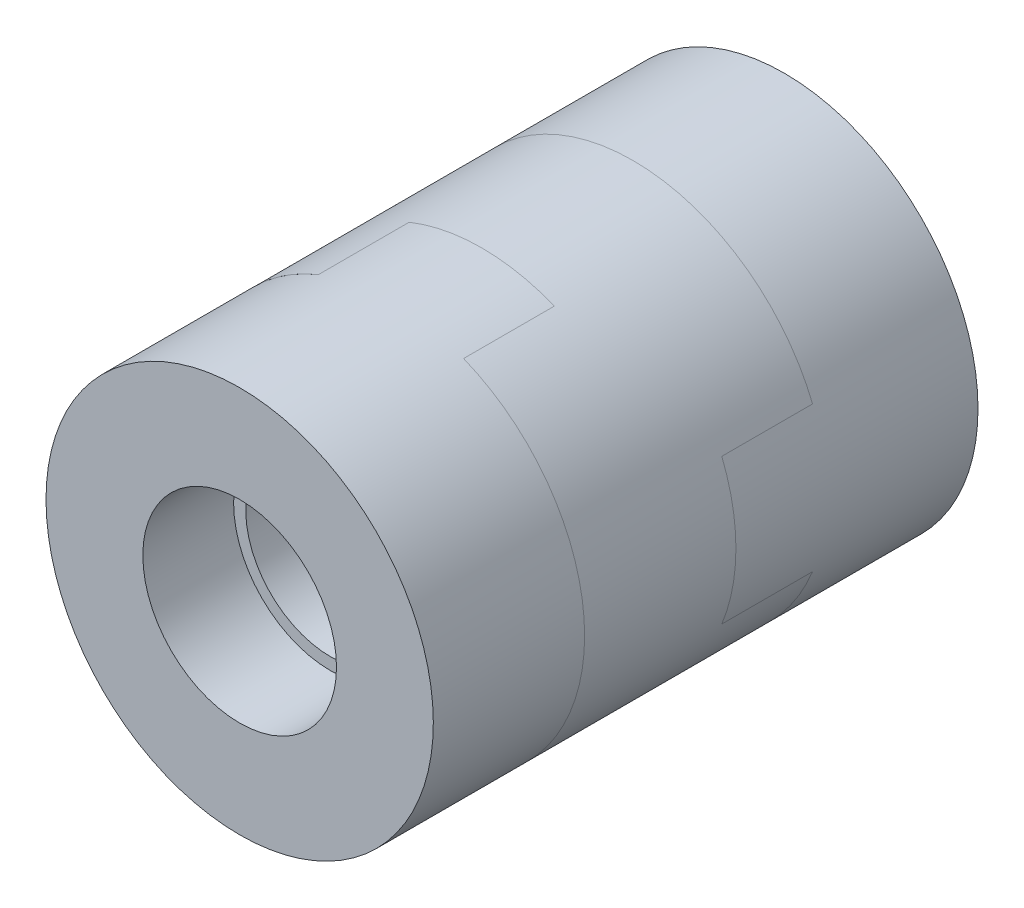
from build123d import *
from build123d.topology import SkipClean

# Parameters (mm, degrees)
CROQUIS2_R                 = 16
CROQUIS2_R_2               = 7
SALIENTE_EXTRUIR1_DEPTH    = 12.5
SALIENTE_EXTRUIR2_DEPTH    = 7.5
SALIENTE_EXTRUIR3_DEPTH    = 7.5
SALIENTE_EXTRUIR3_2_DEPTH  = 7.5
CROQUIS5_R                 = 16
CROQUIS5_R_2               = 7
SALIENTE_EXTRUIR5_DEPTH    = 5
SALIENTE_EXTRUIR7_DEPTH    = 7.5
S_LIDO_MOVER_COPIAR8_ANGLE = 180
S_LIDO_MOVER_COPIAR9_ANGLE = 90
CROQUIS7_R                 = 8
CORTAR_EXTRUIR1_DEPTH      = 7.5


with BuildPart() as part:
    # Croquis2 → Saliente-Extruir1 (new body)
    with BuildSketch(Plane.XY):
        Circle(CROQUIS2_R)
        Circle(CROQUIS2_R_2, mode=Mode.SUBTRACT)
    extrude(amount=SALIENTE_EXTRUIR1_DEPTH)

    # Croquis3 → Saliente-Extruir2 (add)
    with SkipClean():  # the faces are left unmerged after this step: merging them gives an invalid solid
        with BuildSketch(Plane.XY.offset(12.5)):
            with BuildLine():
                Line((-14.832396974, 6), (-3.605551275, 6))
                ThreePointArc((-3.605551275, 6), (-7, 0), (-3.605551275, -6))
                Line((-3.605551275, -6), (-14.832396974, -6))
                ThreePointArc((-14.832396974, -6), (-16, 0), (-14.832396974, 6))
            make_face()
            with BuildLine():
                Line((3.605551275, 6), (14.832396974, 6))
                ThreePointArc((14.832396974, 6), (16, 0), (14.832396974, -6))
                Line((14.832396974, -6), (3.605551275, -6))
                ThreePointArc((3.605551275, -6), (7, 0), (3.605551275, 6))
            make_face()
        extrude(amount=SALIENTE_EXTRUIR2_DEPTH)


with BuildPart() as body_2:
    # Croquis4 → Saliente-Extruir3 (new body)
    with BuildSketch(Plane.XY.offset(12.5)):
        with BuildLine():
            Line((-14.832396974, 6), (-3.605551275, 6))
            ThreePointArc((-3.605551275, 6), (0, 7), (3.605551275, 6))
            Line((3.605551275, 6), (14.832396974, 6))
            ThreePointArc((14.832396974, 6), (0, 16), (-14.832396974, 6))
        make_face()
    extrude(amount=SALIENTE_EXTRUIR3_DEPTH)


with BuildPart() as body_3:
    # Croquis4 → Saliente-Extruir3 2 (new body)
    with BuildSketch(Plane.XY.offset(12.5)):
        with BuildLine():
            Line((14.832396974, -6), (3.605551275, -6))
            ThreePointArc((3.605551275, -6), (0, -7), (-3.605551275, -6))
            Line((-3.605551275, -6), (-14.832396974, -6))
            ThreePointArc((-14.832396974, -6), (0, -16), (14.832396974, -6))
        make_face()
    extrude(amount=SALIENTE_EXTRUIR3_2_DEPTH)


with BuildPart() as body_4:
    # Croquis5 → Saliente-Extruir5 (new body)
    with BuildSketch(Plane.XY.offset(20)):
        Circle(CROQUIS5_R)
        Circle(CROQUIS5_R_2, mode=Mode.SUBTRACT)
    extrude(amount=SALIENTE_EXTRUIR5_DEPTH)


with BuildPart() as body_2_1:
    add(body_2.part)

    # Combinar1: union body 4, body 3
    add(body_4.part)
    add(body_3.part)

    # Croquis6 → Saliente-Extruir7 (add)
    with SkipClean():  # the faces are left unmerged after this step: merging them gives an invalid solid
        with BuildSketch(Plane.XY.offset(25)):
            with BuildLine():
                Line((-6, -14.832396974), (-6, -3.605551275))
                ThreePointArc((-6, -3.605551275), (-7, 0), (-6, 3.605551275))
                Line((-6, 3.605551275), (-6, 14.832396974))
                ThreePointArc((-6, 14.832396974), (-16, 0), (-6, -14.832396974))
            make_face()
            with BuildLine():
                Line((6, -14.832396974), (6, -3.605551275))
                ThreePointArc((6, -3.605551275), (7, 0), (6, 3.605551275))
                Line((6, 3.605551275), (6, 14.832396974))
                ThreePointArc((6, 14.832396974), (16, 0), (6, -14.832396974))
            make_face()
        extrude(amount=SALIENTE_EXTRUIR7_DEPTH)


with BuildPart() as body_3_2:
    # Sólido-Mover/Copiar6: copy of part
    add(part.part.moved(Location((0, 0, 32.5))))


with BuildPart() as body_3_2_1:
    # Sólido-Mover/Copiar8: moved
    add(body_3_2.part.rotate(Axis((0, 0, 42.5), (0, 1, 0)), S_LIDO_MOVER_COPIAR8_ANGLE))


with BuildPart() as body_3_2_2:
    # Sólido-Mover/Copiar9: moved
    add(body_3_2_1.part.rotate(Axis((0, 0, 0), (0, 0, 1)), S_LIDO_MOVER_COPIAR9_ANGLE))


with BuildPart() as body_3_2_3:
    # Sólido-Mover/Copiar10: moved
    add(body_3_2_2.part.moved(Location((0, 0, -7.5))))

    # Croquis7 → Cortar-Extruir1 (cut)
    with BuildSketch(Plane.XY.offset(45)):
        Circle(CROQUIS7_R)
    extrude(amount=-CORTAR_EXTRUIR1_DEPTH, mode=Mode.SUBTRACT)


solid = Compound([part.part, body_2_1.part, body_3_2_3.part])
